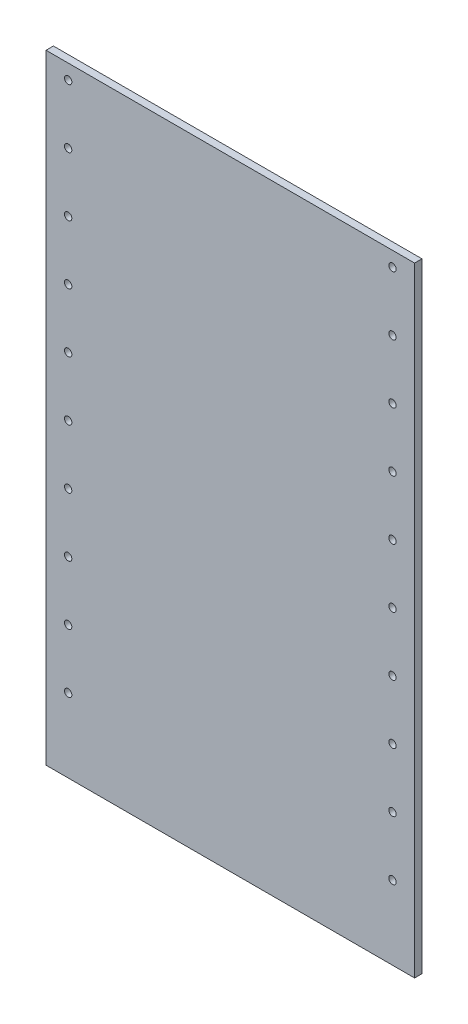
from build123d import *

# Parameters (mm, degrees)
SKETCH1_W           = 158.76
SKETCH1_H           = 266.7
SKETCH1_R           = 1.5875
BOSS_EXTRUDE1_DEPTH = 3.175


with BuildPart() as part:
    # Sketch1 → Boss-Extrude1 (new body)
    with BuildSketch(Plane.XY):
        with Locations((79.38, -133.35)):
            Rectangle(SKETCH1_W, SKETCH1_H)
        with Locations((9.53, -6.35)):
            Circle(SKETCH1_R, mode=Mode.SUBTRACT)
        with Locations((149.23, -6.35)):
            Circle(SKETCH1_R, mode=Mode.SUBTRACT)
        with Locations((149.23, -31.75)):
            Circle(SKETCH1_R, mode=Mode.SUBTRACT)
        with Locations((149.23, -57.15)):
            Circle(SKETCH1_R, mode=Mode.SUBTRACT)
        with Locations((149.23, -82.55)):
            Circle(SKETCH1_R, mode=Mode.SUBTRACT)
        with Locations((149.23, -107.95)):
            Circle(SKETCH1_R, mode=Mode.SUBTRACT)
        with Locations((149.23, -133.35)):
            Circle(SKETCH1_R, mode=Mode.SUBTRACT)
        with Locations((149.23, -158.75)):
            Circle(SKETCH1_R, mode=Mode.SUBTRACT)
        with Locations((149.23, -184.15)):
            Circle(SKETCH1_R, mode=Mode.SUBTRACT)
        with Locations((149.23, -209.55)):
            Circle(SKETCH1_R, mode=Mode.SUBTRACT)
        with Locations((149.23, -234.95)):
            Circle(SKETCH1_R, mode=Mode.SUBTRACT)
        with Locations((9.53, -31.75)):
            Circle(SKETCH1_R, mode=Mode.SUBTRACT)
        with Locations((9.53, -57.15)):
            Circle(SKETCH1_R, mode=Mode.SUBTRACT)
        with Locations((9.53, -82.55)):
            Circle(SKETCH1_R, mode=Mode.SUBTRACT)
        with Locations((9.53, -107.95)):
            Circle(SKETCH1_R, mode=Mode.SUBTRACT)
        with Locations((9.53, -133.35)):
            Circle(SKETCH1_R, mode=Mode.SUBTRACT)
        with Locations((9.53, -158.75)):
            Circle(SKETCH1_R, mode=Mode.SUBTRACT)
        with Locations((9.53, -184.15)):
            Circle(SKETCH1_R, mode=Mode.SUBTRACT)
        with Locations((9.53, -209.55)):
            Circle(SKETCH1_R, mode=Mode.SUBTRACT)
        with Locations((9.53, -234.95)):
            Circle(SKETCH1_R, mode=Mode.SUBTRACT)
    extrude(amount=BOSS_EXTRUDE1_DEPTH)


solid = part.part
